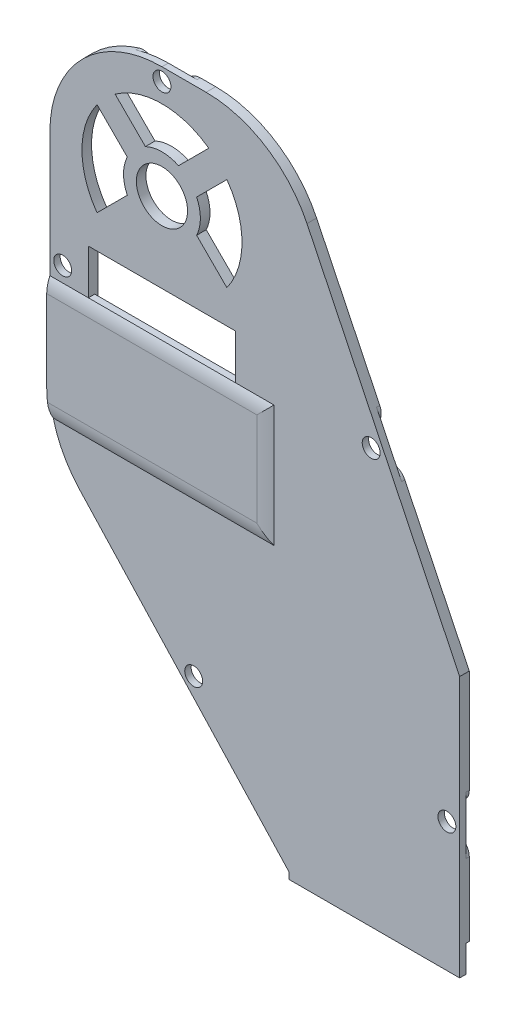
from build123d import *

# Parameters (mm, degrees)
EXTRUDE_1_DEPTH     = 1
EXTRUDE_START       = 0.5
EXTRUDE_2_DEPTH     = 0.5
FILLET_1_R          = 2.25
CUT_EXTRUDE_1_REACH = 96.707
SKETCH_3_R          = 1.4
CUT_EXTRUDE_2_REACH = 96.714
SKETCH_4_R          = 4
SKETCH_4_W          = 23
SKETCH_4_H          = 20
EXTRUDE_3_DEPTH     = 1.5
FILLET_START        = -18
FILLET_2_DEPTH      = 35.5
FILLET_START_2      = -39
FILLET_2_2_DEPTH    = 20


with BuildPart() as part:
    # 스케치1 → 보스-돌출1 (new body)
    with BuildSketch(Plane.XY):
        with BuildLine():
            Line((46.5, -82.5), (46.5, -41.72899408))
            Line((46.5, -41.72899408), (22.650184607, 7.615451559))
            ThreePointArc((22.650184607, 7.615451559), (16.194067118, 14.824311152), (6.894077933, 17.5))
            Line((6.894077933, 17.5), (0, 17.5))
            ThreePointArc((0, 17.5), (-12.374368671, 12.374368671), (-17.5, 0))
            Line((-17.5, 0), (-17.5, -34.255734548))
            ThreePointArc((-17.5, -34.255734548), (-16.295213306, -40.636645401), (-12.846740193, -46.138969227))
            Line((-12.846740193, -46.138969227), (19.862213273, -81.5))
            Line((19.862213273, -81.5), (19.862213273, -82.5))
            Line((19.862213273, -82.5), (46.5, -82.5))
        make_face()
    extrude(amount=EXTRUDE_1_DEPTH)

    # 스케치2 → 보스-돌출2 (add)
    with BuildSketch(Plane(origin=(0, 0, 0), x_dir=(-1, 0, 0), z_dir=(0, 0, -1)).offset(EXTRUDE_START)):
        with BuildLine():
            Line((-41.3, -81.3), (-41.3, -78.3))
            Line((-41.3, -78.3), (-46.5, -78.3))
            Line((-46.5, -78.3), (-46.5, -64.59349112))
            Line((-46.5, -64.59349112), (-44.5, -64.59349112))
            ThreePointArc((-44.5, -64.59349112), (-42.25, -62.34349112), (-44.5, -60.09349112))
            Line((-44.5, -60.09349112), (-46.5, -60.09349112))
            Line((-46.5, -60.09349112), (-46.5, -41.72899408))
            Line((-46.5, -41.72899408), (-35.454570743, -18.876381824))
            Line((-35.454570743, -18.876381824), (-33.653872837, -19.746719145))
            ThreePointArc((-33.653872837, -19.746719145), (-30.648958207, -18.700063487), (-31.695613865, -15.695148857))
            Line((-31.695613865, -15.695148857), (-33.49631177, -14.824811536))
            Line((-33.49631177, -14.824811536), (-22.650184607, 7.615451559))
            ThreePointArc((-22.650184607, 7.615451559), (-16.194067118, 14.824311152), (-6.894077933, 17.5))
            Line((-6.894077933, 17.5), (-2.25, 17.5))
            Line((-2.25, 17.5), (-2.25, 15.5))
            ThreePointArc((-2.25, 15.5), (0, 13.25), (2.25, 15.5))
            Line((2.25, 15.5), (2.25, 17.354754392))
            ThreePointArc((2.25, 17.354754392), (13.145816825, 11.551515052), (17.5, 0))
            Line((17.5, 0), (17.5, -14.877867274))
            Line((17.5, -14.877867274), (15.5, -14.877867274))
            ThreePointArc((15.5, -14.877867274), (13.25, -17.127867274), (15.5, -19.377867274))
            Line((15.5, -19.377867274), (17.5, -19.377867274))
            Line((17.5, -19.377867274), (17.5, -34.255734548))
            ThreePointArc((17.5, -34.255734548), (16.295213306, -40.636645401), (12.846740193, -46.138969227))
            Line((12.846740193, -46.138969227), (-1.961163732, -62.14751401))
            Line((-1.961163732, -62.14751401), (-3.429362611, -60.789430047))
            ThreePointArc((-3.429362611, -60.789430047), (-6.608930809, -60.913309328), (-6.485051529, -64.092877525))
            Line((-6.485051529, -64.092877525), (-5.016852649, -65.450961488))
            Line((-5.016852649, -65.450961488), (-16.902213273, -78.3))
            Line((-16.902213273, -78.3), (-25.062213273, -78.3))
            Line((-25.062213273, -78.3), (-25.062213273, -81.3))
            Line((-25.062213273, -81.3), (-41.3, -81.3))
        make_face()
    extrude(amount=-EXTRUDE_2_DEPTH)

    # 필렛1
    # the kernel refuses this fillet: 2.25 mm, written as the material it takes off along each edge
    with BuildSketch(Plane(origin=(16.902213273, -78.3, -2.959324658), x_dir=(1, 0, 0), z_dir=(0, 0, 1))) as fillet_1_piece_1:
        with BuildLine():
            CenterArc((FILLET_1_R * 0.437213272583, FILLET_1_R), FILLET_1_R, 222.768825392, 47.231174608)
            Line((-FILLET_1_R * 0.296886167004, FILLET_1_R * 0.320958018383), (0, 0))
            Line((0, 0), (FILLET_1_R * 0.437213272583, 0))
        make_face()
    extrude(amount=2.959324658, mode=Mode.SUBTRACT)
    with BuildSketch(Plane(origin=(41.3, -81.3, -6.125), x_dir=(0, 1, 0), z_dir=(0, 0, 1)), Plane(origin=(25.062213273, -81.3, -6.125), x_dir=(1, 0, 0), z_dir=(0, 0, 1))) as fillet_1_piece_2:
        with BuildLine():
            CenterArc((FILLET_1_R, FILLET_1_R), FILLET_1_R, 180, 90)
            Line((0, FILLET_1_R), (0, 0))
            Line((0, 0), (FILLET_1_R, 0))
        make_face()
    extrude(amount=6.125, mode=Mode.SUBTRACT)
    with BuildSketch(Plane(origin=(-17.5, -14.877867274, -6.107625472), x_dir=(0, 1, 0), z_dir=(0, 0, 1)), Plane(origin=(46.5, -64.59349112, -6.107625472), x_dir=(0, -1, 0), z_dir=(0, 0, 1)), Plane(origin=(1.961163732, -62.14751401, -6.107625472), x_dir=(-0.679041981617428, 0.7340994395864068, 0), z_dir=(0, 0, 1))) as fillet_1_piece_3:
        with BuildLine():
            CenterArc((2.243050189, -2.25), FILLET_1_R, 90, 86.815261463)
            Line((-0.003474906, -2.125), (-0.228127415, -2.1125))
            ThreePointArc((-0.228127415, -2.1125), (-0.225, -2), (-0.225, 0))
            Line((-0.225, 0), (0, 0.225))
            Line((0, 0.225), (2.243050189, 0.225))
            Line((2.243050189, 0.225), (2.243050189, 0))
        make_face()
    extrude(amount=6.107625472, mode=Mode.SUBTRACT)
    with BuildSketch(Plane(origin=(-17.5, -19.377867274, -6.107625472), x_dir=(0, -1, 0), z_dir=(0, 0, 1)), Plane(origin=(46.5, -60.09349112, -6.107625472), x_dir=(0, 1, 0), z_dir=(0, 0, 1)), Plane(origin=(5.016852649, -65.450961488, -6.107625472), x_dir=(0.6790419816174277, -0.7340994395864073, 0), z_dir=(0, 0, 1))) as fillet_1_piece_4:
        with BuildLine():
            CenterArc((2.243050189, 2.25), FILLET_1_R, 183.184738537, 86.815261463)
            Line((-0.003474906, 2.125), (-0.228127415, 2.1125))
            ThreePointArc((-0.228127415, 2.1125), (-0.225, 2), (-0.225, 0))
            Line((-0.225, 0), (0, -0.225))
            Line((0, -0.225), (2.243050189, -0.225))
            Line((2.243050189, -0.225), (2.243050189, 0))
        make_face()
    extrude(amount=6.107625472, mode=Mode.SUBTRACT)
    with BuildSketch(Plane(origin=(2.25, 17.5, -6.107625472), x_dir=(-0.0016352474835574222, -0.99999866298194, 0), z_dir=(0, 0, 1)), Plane(origin=(35.454570743, -18.876381824, -6.107625472), x_dir=(-0.901059357516204, -0.4336957853524583, 0), z_dir=(0, 0, 1))) as fillet_1_piece_5:
        with BuildLine():
            CenterArc((2.24632905, 2.246726497), FILLET_1_R, 180.093692821, 86.815261463)
            Line((-0.003667942, 2.24304719), (-0.228667641, 2.242679259))
            Line((-0.228667641, 2.242679259), (-0.224999699, -0.000367931))
            Line((-0.224999699, -0.000367931), (0.000367931, -0.224999699))
            ThreePointArc((0.000367931, -0.224999699), (2.000365257, -0.221729204), (2.11287022, -0.22467265))
            Line((2.11287022, -0.22467265), (2.125002841, 0))
        make_face()
    extrude(amount=6.107625472, mode=Mode.SUBTRACT)
    with BuildSketch(Plane(origin=(-2.25, 17.354754392, -7.682759743), x_dir=(-0.9777990320246813, -0.2095448710219276, 0), z_dir=(0, 0, 1))) as fillet_1_piece_6:
        with BuildLine():
            CenterArc((2.688404361, 2.242406315), FILLET_1_R, 179.456997301, 95.251636128)
            Line((0.438505404, 2.263729662), (0.213515509, 2.265861997))
            ThreePointArc((0.213515509, 2.265861997), (0.168649488, 1.860724645), (-0.220004782, 0.047147596))
            Line((-0.220004782, 0.047147596), (-0.018469954, -0.224240631))
            ThreePointArc((-0.018469954, -0.224240631), (1.436551949, -0.284061995), (2.891573851, -0.224240631))
            Line((2.891573851, -0.224240631), (2.873103897, 0))
        make_face()
    extrude(amount=7.682759743, mode=Mode.SUBTRACT)
    with BuildSketch(Plane(origin=(33.49631177, -14.824811536, -6.107625472), x_dir=(-0.8996361406020625, -0.43664037207137185, 0), z_dir=(0, 0, 1))) as fillet_1_piece_7:
        with BuildLine():
            CenterArc((2.24632905, -2.246726497), FILLET_1_R, 93.091045716, 86.815261463)
            Line((-0.003667942, -2.24304719), (-0.228667641, -2.242679259))
            Line((-0.228667641, -2.242679259), (-0.224999699, 0.000367931))
            Line((-0.224999699, 0.000367931), (0.000367931, 0.224999699))
            ThreePointArc((0.000367931, 0.224999699), (2.000365257, 0.221729204), (2.11287022, 0.22467265))
            Line((2.11287022, 0.22467265), (2.125002841, 0))
        make_face()
    extrude(amount=6.107625472, mode=Mode.SUBTRACT)

    # 스케치3 → 컷-돌출1 (cut, up to next)
    with BuildSketch(Plane(origin=(0, 0, 0), x_dir=(-1, 0, 0), z_dir=(0, 0, -1)), mode=Mode.PRIVATE) as cut_extrude_1_sk1:
        with Locations((0, 15.5)):
            Circle(SKETCH_3_R)
    cut_extrude_1_tool1 = extrude(cut_extrude_1_sk1.sketch, amount=-CUT_EXTRUDE_1_REACH, mode=Mode.PRIVATE) & part.part
    # 스케치3 → 컷-돌출1 (cut, up to next)
    with BuildSketch(Plane(origin=(0, 0, 0), x_dir=(-1, 0, 0), z_dir=(0, 0, -1)), mode=Mode.PRIVATE) as cut_extrude_1_sk2:
        with Locations((15.5, -17.127867274)):
            Circle(SKETCH_3_R)
    cut_extrude_1_tool2 = extrude(cut_extrude_1_sk2.sketch, amount=-CUT_EXTRUDE_1_REACH, mode=Mode.PRIVATE) & part.part
    # 스케치3 → 컷-돌출1 (cut, up to next)
    with BuildSketch(Plane(origin=(0, 0, 0), x_dir=(-1, 0, 0), z_dir=(0, 0, -1)), mode=Mode.PRIVATE) as cut_extrude_1_sk3:
        with Locations((-32.674743351, -17.720934001)):
            Circle(SKETCH_3_R)
    cut_extrude_1_tool3 = extrude(cut_extrude_1_sk3.sketch, amount=-CUT_EXTRUDE_1_REACH, mode=Mode.PRIVATE) & part.part
    # 스케치3 → 컷-돌출1 (cut, up to next)
    with BuildSketch(Plane(origin=(0, 0, 0), x_dir=(-1, 0, 0), z_dir=(0, 0, -1)), mode=Mode.PRIVATE) as cut_extrude_1_sk4:
        with Locations((-44.5, -62.34349112)):
            Circle(SKETCH_3_R)
    cut_extrude_1_tool4 = extrude(cut_extrude_1_sk4.sketch, amount=-CUT_EXTRUDE_1_REACH, mode=Mode.PRIVATE) & part.part
    # 스케치3 → 컷-돌출1 (cut, up to next)
    with BuildSketch(Plane(origin=(0, 0, 0), x_dir=(-1, 0, 0), z_dir=(0, 0, -1)), mode=Mode.PRIVATE) as cut_extrude_1_sk5:
        with Locations((-4.95720707, -62.441153786)):
            Circle(SKETCH_3_R)
    cut_extrude_1_tool5 = extrude(cut_extrude_1_sk5.sketch, amount=-CUT_EXTRUDE_1_REACH, mode=Mode.PRIVATE) & part.part
    add(cut_extrude_1_tool1.solids().sort_by_distance((0, 15.5, 0))[0], mode=Mode.SUBTRACT)
    add(cut_extrude_1_tool2.solids().sort_by_distance((-15.5, -17.127867, 0))[0], mode=Mode.SUBTRACT)
    add(cut_extrude_1_tool3.solids().sort_by_distance((32.674743, -17.720934, 0))[0], mode=Mode.SUBTRACT)
    add(cut_extrude_1_tool4.solids().sort_by_distance((44.5, -62.343491, 0))[0], mode=Mode.SUBTRACT)
    add(cut_extrude_1_tool5.solids().sort_by_distance((4.957207, -62.441154, 0))[0], mode=Mode.SUBTRACT)

    # 스케치4 → 컷-돌출2 (cut, up to next)
    with BuildSketch(Plane(origin=(0, 0, -0.5), x_dir=(-1, 0, 0), z_dir=(0, 0, -1)), mode=Mode.PRIVATE) as cut_extrude_2_sk1:
        Circle(SKETCH_4_R)
    cut_extrude_2_tool1 = extrude(cut_extrude_2_sk1.sketch, amount=-CUT_EXTRUDE_2_REACH, mode=Mode.PRIVATE) & part.part
    # 스케치4 → 컷-돌출2 (cut, up to next)
    with BuildSketch(Plane(origin=(0, 0, -0.5), x_dir=(-1, 0, 0), z_dir=(0, 0, -1)), mode=Mode.PRIVATE) as cut_extrude_2_sk2:
        with Locations((0, -22.5)):
            Rectangle(SKETCH_4_W, SKETCH_4_H)
    cut_extrude_2_tool2 = extrude(cut_extrude_2_sk2.sketch, amount=-CUT_EXTRUDE_2_REACH, mode=Mode.PRIVATE) & part.part
    # 스케치4 → 컷-돌출2 (cut, up to next)
    with BuildSketch(Plane(origin=(0, 0, -0.5), x_dir=(-1, 0, 0), z_dir=(0, 0, -1)), mode=Mode.PRIVATE) as cut_extrude_2_sk3:
        with BuildLine():
            Line((-5.414213562, -2.585786438), (-10.139177746, -7.310750621))
            ThreePointArc((-10.139177746, -7.310750621), (-12.5, 0), (-10.139177746, 7.310750621))
            Line((-10.139177746, 7.310750621), (-5.414213562, 2.585786438))
            ThreePointArc((-5.414213562, 2.585786438), (-6, 0), (-5.414213562, -2.585786438))
        make_face()
    cut_extrude_2_tool3 = extrude(cut_extrude_2_sk3.sketch, amount=-CUT_EXTRUDE_2_REACH, mode=Mode.PRIVATE) & part.part
    # 스케치4 → 컷-돌출2 (cut, up to next)
    with BuildSketch(Plane(origin=(0, 0, -0.5), x_dir=(-1, 0, 0), z_dir=(0, 0, -1)), mode=Mode.PRIVATE) as cut_extrude_2_sk4:
        with BuildLine():
            Line((5.414213562, -2.585786438), (10.139177746, -7.310750621))
            ThreePointArc((10.139177746, -7.310750621), (12.5, 0), (10.139177746, 7.310750621))
            Line((10.139177746, 7.310750621), (5.414213562, 2.585786438))
            ThreePointArc((5.414213562, 2.585786438), (6, 0), (5.414213562, -2.585786438))
        make_face()
    cut_extrude_2_tool4 = extrude(cut_extrude_2_sk4.sketch, amount=-CUT_EXTRUDE_2_REACH, mode=Mode.PRIVATE) & part.part
    # 스케치4 → 컷-돌출2 (cut, up to next)
    with BuildSketch(Plane(origin=(0, 0, -0.5), x_dir=(-1, 0, 0), z_dir=(0, 0, -1)), mode=Mode.PRIVATE) as cut_extrude_2_sk5:
        with BuildLine():
            Line((2.585786438, 5.414213562), (7.310750621, 10.139177746))
            ThreePointArc((7.310750621, 10.139177746), (0, 12.5), (-7.310750621, 10.139177746))
            Line((-7.310750621, 10.139177746), (-2.585786438, 5.414213562))
            ThreePointArc((-2.585786438, 5.414213562), (0, 6), (2.585786438, 5.414213562))
        make_face()
    cut_extrude_2_tool5 = extrude(cut_extrude_2_sk5.sketch, amount=-CUT_EXTRUDE_2_REACH, mode=Mode.PRIVATE) & part.part
    add(cut_extrude_2_tool1.solids().sort_by_distance((0, 0, -0.5))[0], mode=Mode.SUBTRACT)
    add(cut_extrude_2_tool2.solids().sort_by_distance((0, -22.5, -0.5))[0], mode=Mode.SUBTRACT)
    add(cut_extrude_2_tool3.solids().sort_by_distance((9.239512, 0, -0.5))[0], mode=Mode.SUBTRACT)
    add(cut_extrude_2_tool4.solids().sort_by_distance((-9.239512, 0, -0.5))[0], mode=Mode.SUBTRACT)
    add(cut_extrude_2_tool5.solids().sort_by_distance((0, 9.239512, -0.5))[0], mode=Mode.SUBTRACT)

    # 스케치6 → 보스-돌출3 (add)
    with BuildSketch(Plane(origin=(0, 0, 0), x_dir=(-1, 0, 0), z_dir=(0, 0, -1))):
        with BuildLine():
            Line((17.5, -19.5), (-17.5, -19.5))
            Line((-17.5, -19.5), (-17.5, -38.5))
            Line((-17.5, -38.5), (16.977520749, -38.5))
            ThreePointArc((16.977520749, -38.5), (17.368889042, -36.393886425), (17.5, -34.255734548))
            Line((17.5, -34.255734548), (17.5, -19.5))
        make_face()
    extrude(amount=-EXTRUDE_3_DEPTH)

    # 필렛2: read off the stored shape, not the designer's step
    # 필렛2 outline → 필렛2 (cut)
    with BuildSketch(Plane.YZ.offset(FILLET_START)):
        with BuildLine():
            Line((-38.5, 1.5), (-38.5, 1))
            ThreePointArc((-38.5, 1), (-37.438584517, 1.373397172), (-36.320550528, 1.5))
            Line((-36.320550528, 1.5), (-38.5, 1.5))
        make_face()
        with BuildLine():
            Line((-19.5, 1.5), (-21.679449472, 1.5))
            ThreePointArc((-21.679449472, 1.5), (-20.561415483, 1.373397172), (-19.5, 1))
            Line((-19.5, 1), (-19.5, 1.5))
        make_face()
    extrude(amount=FILLET_2_DEPTH, mode=Mode.SUBTRACT)

    # Fillet 2 2 outline → Fillet 2 2 (cut)
    with BuildSketch(Plane(origin=(0, 0, 0), x_dir=(1, 0, 0), z_dir=(0, 1, 0)).offset(FILLET_START_2)):
        with BuildLine():
            Line((17.5, -1.5), (17.5, -1))
            ThreePointArc((17.5, -1), (16.438584517, -1.373397172), (15.320550528, -1.5))
            Line((15.320550528, -1.5), (17.5, -1.5))
        make_face()
    extrude(amount=FILLET_2_2_DEPTH, mode=Mode.SUBTRACT)


solid = part.part
